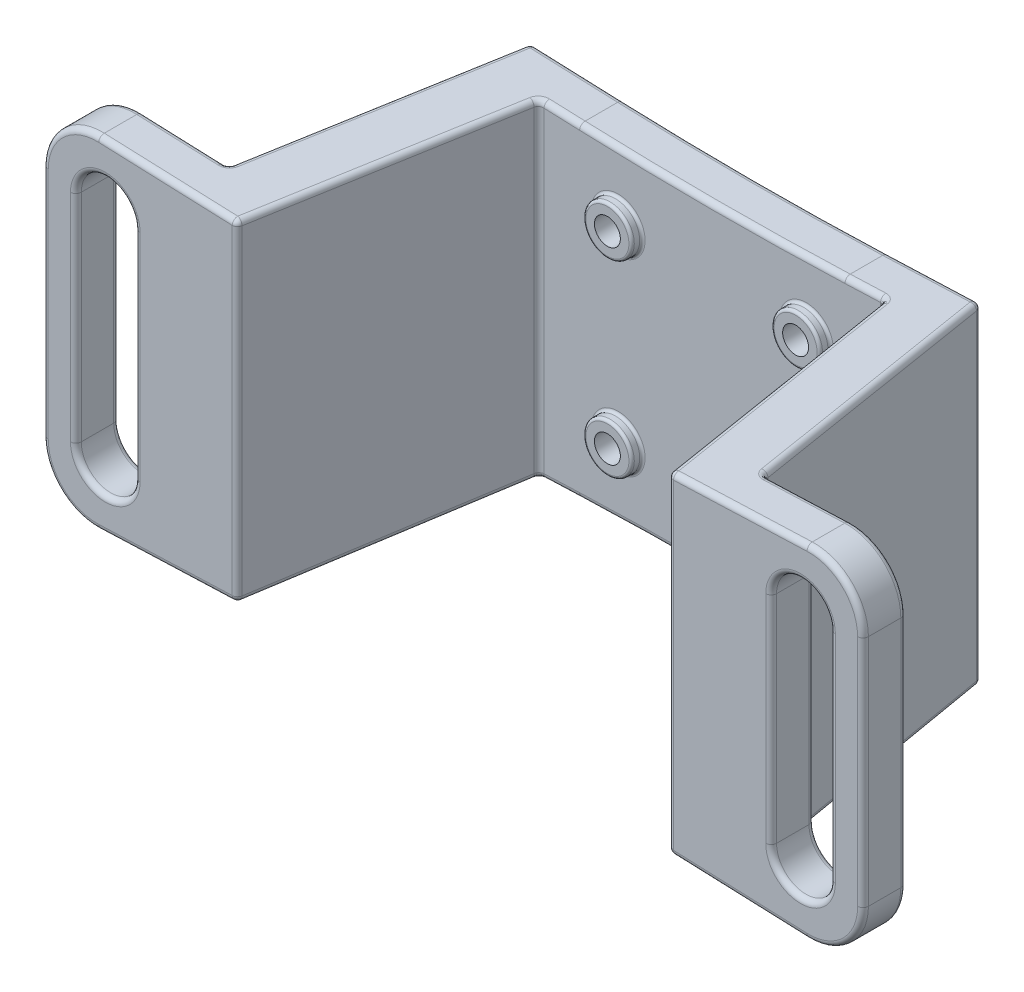
from build123d import *

# Parameters (mm, degrees)
SKETCH1_R           = 1.9049999999999998
SKETCH1_R_2         = 1.905
SKETCH1_R_3         = 1.9050000000000002
BOSS_EXTRUDE1_DEPTH = 3.175
FILLET1_R           = 3.96875
BOSS_EXTRUDE2_START = -1.5875
SKETCH2_R           = 1.9050000000000002
SKETCH2_R_2         = 0.9525000000000001
SKETCH2_R_3         = 1.905
SKETCH2_R_4         = 0.9525
SKETCH2_R_5         = 1.9049999999999998
SKETCH2_R_6         = 0.9525000000000002
SKETCH2_R_7         = 0.9525000000000003
BOSS_EXTRUDE2_DEPTH = 1.5875
SKETCH4_R           = 1.778
SKETCH4_R_2         = 0.9525000000000005
SKETCH4_R_3         = 1.7779999999999996
SKETCH4_R_4         = 0.9525000000000002
SKETCH4_R_5         = 0.9525000000000001
SKETCH4_R_6         = 0.9525
BOSS_EXTRUDE3_DEPTH = 0.79375
BOSS_EXTRUDE4_DEPTH = 19.05
CUT_EXTRUDE1_DEPTH  = 19.05
CHAMFER1_SIZE       = 3.175
CHAMFER1_SIZE_2     = 19.05
CHAMFER4_SIZE       = 3.175
CHAMFER4_SIZE_2     = 19.05
CHAMFER2_SIZE       = 19.05
CHAMFER2_SIZE_2     = 3.175
CHAMFER3_SIZE       = 3.175
CHAMFER3_SIZE_2     = 19.05
FILLET2_R           = 0.1984375
FILLET4_R           = 254
FILLET3_R           = 0.396875


with BuildPart() as part:
    # Sketch1 → Boss-Extrude1 (new body)
    # profile 1 of 3: a face of its own
    with BuildSketch(Plane.XY):
        Polygon((18.191489852910465, 4.201032999999999), (6.911467000002631, 4.633592791574014), (-4.368555852910468, 4.201032999999999), (-4.368555852910467, -18.023967), (6.911467000002645, -18.456526791574216), (18.191489852910465, -18.023967), align=None)
        with Locations((0, -13.822933999999998)):
            Circle(SKETCH1_R, mode=Mode.SUBTRACT)
        with Locations((13.822933999999998, -13.822933999999995)):
            Circle(SKETCH1_R_2, mode=Mode.SUBTRACT)
        Circle(SKETCH1_R_2, mode=Mode.SUBTRACT)
        with Locations((13.822933999999998, 0)):
            Circle(SKETCH1_R_3, mode=Mode.SUBTRACT)
    # profile 2 of 3: a face of its own
    with BuildSketch(Plane.XY):
        Polygon((6.911467000002631, 4.633592791574014), (-23.206339135841382, 5.788532999999999), (-23.206339135841382, -19.611466999999998), (6.911467000002652, -18.456526791574014), (-4.368555852910468, -18.023967), (-4.368555852910467, 4.201032999999999), align=None)
        with BuildLine():
            ThreePointArc((-20.77872400000001, 1.026033000000001), (-18.619723999999994, 3.185033000000017), (-16.460723999999978, 1.0260330000000009))
            Line((-16.46072399999998, 1.0260330000000009), (-16.46072399999998, -14.848966999999998))
            ThreePointArc((-16.460723999999978, -14.848967), (-18.619723999999994, -17.007967000000015), (-20.77872400000001, -14.848967))
            Line((-20.77872400000001, -14.848966999999998), (-20.77872400000001, 1.0260330000000009))
        make_face(mode=Mode.SUBTRACT)
    # profile 3 of 3: a face of its own
    with BuildSketch(Plane.XY):
        Polygon((37.02927313584138, 5.788532999999999), (6.911467000002624, 4.633592791574215), (18.191489852910465, 4.201032999999999), (18.191489852910465, -18.023967), (6.911467000002652, -18.456526791574014), (37.02927313584138, -19.611467), align=None)
        with BuildLine():
            Line((30.283657999999978, -14.848966999999998), (30.283657999999978, 1.0260330000000009))
            ThreePointArc((30.28365799999998, 1.0260330000000009), (32.442657999999994, 3.185033000000025), (34.60165800000001, 1.0260330000000015))
            Line((34.60165800000001, 1.0260330000000009), (34.60165800000001, -14.848966999999998))
            ThreePointArc((34.60165800000001, -14.848967), (32.442657999999994, -17.007967000000008), (30.28365799999998, -14.848967))
        make_face(mode=Mode.SUBTRACT)
    extrude(amount=BOSS_EXTRUDE1_DEPTH)

    # Fillet1
    fillet1_edges = [part.edges().sort_by_distance(p)[0] for p in [
        (37.02927313584138, 5.788532999999999, 1.5875),
        (37.02927313584138, -19.611466999999998, 1.5875),
        (-23.206339135841382, -19.611466999999998, 1.5875),
        (-23.206339135841382, 5.788532999999999, 1.5875),
    ]]
    fillet(fillet1_edges, radius=FILLET1_R)

    # Sketch2 → Boss-Extrude2 (add)
    # profile 1 of 4: a face of its own
    with BuildSketch(Plane.XY.offset(3.175).offset(BOSS_EXTRUDE2_START)):
        with Locations((13.822933999999998, 0)):
            Circle(SKETCH2_R)
        with Locations((13.822933999999998, 0)):
            Circle(SKETCH2_R_2, mode=Mode.SUBTRACT)
    # profile 2 of 4: a face of its own
    with BuildSketch(Plane.XY.offset(3.175).offset(BOSS_EXTRUDE2_START)):
        with Locations((13.822933999999998, -13.822933999999995)):
            Circle(SKETCH2_R_3)
        with Locations((13.822933999999998, -13.822933999999995)):
            Circle(SKETCH2_R_4, mode=Mode.SUBTRACT)
    # profile 3 of 4: a face of its own
    with BuildSketch(Plane.XY.offset(3.175).offset(BOSS_EXTRUDE2_START)):
        with Locations((0, -13.822933999999998)):
            Circle(SKETCH2_R_5)
        with Locations((0, -13.822933999999998)):
            Circle(SKETCH2_R_6, mode=Mode.SUBTRACT)
    # profile 4 of 4: a face of its own
    with BuildSketch(Plane.XY.offset(3.175).offset(BOSS_EXTRUDE2_START)):
        Circle(SKETCH2_R_3)
        Circle(SKETCH2_R_7, mode=Mode.SUBTRACT)
    extrude(amount=BOSS_EXTRUDE2_DEPTH)

    # Sketch4 → Boss-Extrude3 (add)
    # profile 1 of 4: a face of its own
    with BuildSketch(Plane.XY.offset(3.175)):
        Circle(SKETCH4_R)
        Circle(SKETCH4_R_2, mode=Mode.SUBTRACT)
    # profile 2 of 4: a face of its own
    with BuildSketch(Plane.XY.offset(3.175)):
        with Locations((0, -13.822933999999998)):
            Circle(SKETCH4_R_3)
        with Locations((0, -13.822933999999998)):
            Circle(SKETCH4_R_4, mode=Mode.SUBTRACT)
    # profile 3 of 4: a face of its own
    with BuildSketch(Plane.XY.offset(3.175)):
        with Locations((13.822933999999998, 0)):
            Circle(SKETCH4_R_3)
        with Locations((13.822933999999998, 0)):
            Circle(SKETCH4_R_5, mode=Mode.SUBTRACT)
    # profile 4 of 4: a face of its own
    with BuildSketch(Plane.XY.offset(3.175)):
        with Locations((13.822933999999998, -13.822933999999995)):
            Circle(SKETCH4_R_3)
        with Locations((13.822933999999998, -13.822933999999995)):
            Circle(SKETCH4_R_6, mode=Mode.SUBTRACT)
    extrude(amount=BOSS_EXTRUDE3_DEPTH)

    # Sketch5 → Boss-Extrude4 (add)
    # profile 1 of 2: a face of its own
    with BuildSketch(Plane(origin=(0, 0, 3.175), x_dir=(-1, 0, 0), z_dir=(0, 0, -1))):
        with BuildLine():
            Line((-32.90844358380976, -19.453443811981426), (-19.611467000000005, -18.94353904541665))
            Line((-19.611467000000008, -18.943539045416653), (-19.611467000000008, 5.120605045416653))
            Line((-19.61146700000001, 5.120605045416652), (-32.90844358380976, 5.630509811981427))
            ThreePointArc((-32.90844358380976, 5.630509811981425), (-35.812559730835574, 4.524267498192314), (-37.02927313584138, 1.6646746701287234))
            Line((-37.02927313584138, 1.664674670128723), (-37.02927313584138, -15.487608670128722))
            ThreePointArc((-37.02927313584138, -15.487608670128722), (-35.812559730835574, -18.347201498192312), (-32.90844358380976, -19.453443811981426))
        make_face()
        with BuildLine():
            Line((-34.60165800000001, -14.848966999999998), (-34.60165800000001, 1.0260330000000009))
            ThreePointArc((-34.60165800000001, 1.0260330000000015), (-32.442657999999994, 3.185033000000025), (-30.28365799999998, 1.0260330000000009))
            Line((-30.283657999999978, 1.026033), (-30.283657999999985, -14.848967))
            ThreePointArc((-30.28365799999998, -14.848967), (-32.442657999999994, -17.007967000000008), (-34.60165800000001, -14.848967))
        make_face(mode=Mode.SUBTRACT)
    # profile 2 of 2: a face of its own
    with BuildSketch(Plane(origin=(0, 0, 3.175), x_dir=(-1, 0, 0), z_dir=(0, 0, -1))):
        with BuildLine():
            Line((5.788532999999995, 5.120605045416653), (5.788532999999994, -18.943539045416653))
            Line((5.788532999999996, -18.943539045416653), (19.08550958380976, -19.453443811981426))
            ThreePointArc((19.08550958380976, -19.453443811981426), (21.989625730835577, -18.34720149819232), (23.206339135841382, -15.487608670128724))
            Line((23.206339135841382, -15.487608670128724), (23.206339135841382, 1.6646746701287238))
            ThreePointArc((23.206339135841382, 1.664674670128724), (21.989625730835577, 4.5242674981923185), (19.08550958380976, 5.630509811981427))
            Line((19.08550958380976, 5.630509811981428), (5.78853299999999, 5.120605045416652))
        make_face()
        with BuildLine():
            Line((20.77872400000001, 1.026033), (20.77872400000001, -14.848967))
            ThreePointArc((20.77872400000001, -14.848967), (18.619723999999994, -17.007967000000015), (16.460723999999978, -14.848967))
            Line((16.46072399999998, -14.848967), (16.46072399999998, 1.026033000000001))
            ThreePointArc((16.460723999999978, 1.0260330000000015), (18.619723999999994, 3.1850330000000135), (20.77872400000001, 1.0260330000000009))
        make_face(mode=Mode.SUBTRACT)
    extrude(amount=-BOSS_EXTRUDE4_DEPTH)

    # Sketch6 → Cut-Extrude1 (cut)
    # profile 1 of 2: a face of its own
    with BuildSketch(Plane.XY):
        with BuildLine():
            Line((-19.08550958380976, -19.453443811981426), (-12.773532999999995, -19.211395785030046))
            Line((-12.773532999999995, -19.211395785030046), (-12.773532999999995, 5.388461785030049))
            Line((-12.773533, 5.3884617850300485), (-19.08550958380976, 5.630509811981428))
            ThreePointArc((-19.08550958380976, 5.630509811981428), (-21.989625730835577, 4.524267498192319), (-23.206339135841382, 1.664674670128724))
            Line((-23.206339135841382, 1.664674670128724), (-23.206339135841382, -15.487608670128724))
            ThreePointArc((-23.206339135841382, -15.487608670128724), (-21.989625730835577, -18.34720149819232), (-19.08550958380976, -19.453443811981426))
        make_face()
        with BuildLine():
            Line((-16.46072399999998, 1.026033), (-16.46072399999998, -14.848967))
            ThreePointArc((-16.460723999999978, -14.848967), (-18.619723999999994, -17.007967000000015), (-20.77872400000001, -14.848967))
            Line((-20.77872400000001, -14.848967), (-20.77872400000001, 1.026033000000001))
            ThreePointArc((-20.77872400000001, 1.026033000000001), (-18.619723999999994, 3.185033000000017), (-16.460723999999978, 1.0260330000000009))
        make_face(mode=Mode.SUBTRACT)
    # profile 2 of 2: a face of its own
    with BuildSketch(Plane.XY):
        with BuildLine():
            Line((26.596467000000008, 5.388461785030049), (26.596467000000008, -19.211395785030046))
            Line((26.59646700000001, -19.211395785030046), (32.90844358380976, -19.453443811981426))
            ThreePointArc((32.90844358380976, -19.453443811981426), (35.812559730835574, -18.347201498192312), (37.02927313584138, -15.487608670128722))
            Line((37.02927313584138, -15.487608670128722), (37.02927313584138, 1.664674670128722))
            ThreePointArc((37.02927313584138, 1.664674670128723), (35.81255973083558, 4.524267498192318), (32.90844358380976, 5.630509811981428))
            Line((32.90844358380976, 5.630509811981427), (26.596467000000008, 5.388461785030048))
        make_face()
        with BuildLine():
            Line((34.60165800000001, 1.026033), (34.60165800000001, -14.848967))
            ThreePointArc((34.60165800000001, -14.848967), (32.442657999999994, -17.007967000000022), (30.28365799999998, -14.848967))
            Line((30.283657999999978, -14.848967), (30.283657999999985, 1.026033000000001))
            ThreePointArc((30.28365799999998, 1.026033000000001), (32.442657999999994, 3.1850330000000064), (34.60165800000001, 1.0260330000000009))
        make_face(mode=Mode.SUBTRACT)
    extrude(amount=CUT_EXTRUDE1_DEPTH, mode=Mode.SUBTRACT)

    # Chamfer1
    # the kernel refuses this chamfer: 19.05, 3.175 mm, written as the material it takes off along each edge
    with BuildSketch(Plane(origin=(-12.773532999999997, -68.71646684317264, 0), x_dir=(0.9750324932942596, 0, -0.22206223681747386), z_dir=(0, 1, 0))) as chamfer1_piece_1_section:
        Polygon((CHAMFER1_SIZE * 0.975032493294, -CHAMFER1_SIZE * 0.222062236817), (-CHAMFER1_SIZE_2 * 0.222062236817, -CHAMFER1_SIZE_2 * 0.975032493294), (0, 0), align=None)
    chamfer1_piece_1 = extrude(amount=123.60999968634529, mode=Mode.PRIVATE)
    chamfer1_piece_1 = split(chamfer1_piece_1, bisect_by=Plane(origin=(-11.920164400412823, -6.911466999999995, 19.05), z_dir=(0, 0, -1)), keep=Keep.TOP, mode=Mode.PRIVATE)
    add(chamfer1_piece_1, mode=Mode.SUBTRACT)

    # Chamfer4
    # the kernel refuses this chamfer: 19.05, 3.175 mm, written as the material it takes off along each edge
    with BuildSketch(Plane(origin=(26.596467000000008, 54.89353284317265, 0), x_dir=(-0.9750324932942595, 0, -0.2220622368174737), z_dir=(0, -1, 0))) as chamfer4_piece_1_section:
        Polygon((CHAMFER4_SIZE * 0.975032493294, -CHAMFER4_SIZE * 0.222062236817), (-CHAMFER4_SIZE_2 * 0.222062236817, -CHAMFER4_SIZE_2 * 0.975032493294), (0, 0), align=None)
    chamfer4_piece_1 = extrude(amount=123.6099996863453, mode=Mode.PRIVATE)
    chamfer4_piece_1 = split(chamfer4_piece_1, bisect_by=Plane(origin=(25.74309840041287, -6.911467000000007, 19.05), z_dir=(0, 0, -1)), keep=Keep.TOP, mode=Mode.PRIVATE)
    add(chamfer4_piece_1, mode=Mode.SUBTRACT)

    # Chamfer2
    # the kernel refuses this chamfer: 19.05, 3.175 mm, written as the material it takes off along each edge
    with BuildSketch(Plane(origin=(19.611467000000008, -68.44861010355925, 22.225), x_dir=(-0.0063262220237778645, 0, -0.999979989257238), z_dir=(0, 1, 0))) as chamfer2_piece_1_section:
        Polygon((CHAMFER2_SIZE * 0.999979989257, -CHAMFER2_SIZE * 0.00632622202378), (-CHAMFER2_SIZE_2 * 0.00632622202378, -CHAMFER2_SIZE_2 * 0.999979989257), (0, 0), align=None)
    chamfer2_piece_1 = extrude(amount=123.07428620711849, mode=Mode.PRIVATE)
    chamfer2_piece_1 = split(chamfer2_piece_1, bisect_by=Plane(origin=(20.46483559958715, -6.911467000000003, 3.175), z_dir=(0, 0, 1)), keep=Keep.TOP, mode=Mode.PRIVATE)
    add(chamfer2_piece_1, mode=Mode.SUBTRACT)

    # Chamfer3
    # the kernel refuses this chamfer: 19.05, 3.175 mm, written as the material it takes off along each edge
    with BuildSketch(Plane(origin=(-5.788532999999996, 54.62567610355924, 22.225), x_dir=(-0.9750324932942596, 0, 0.2220622368174738), z_dir=(4e-17, -1, 0))) as chamfer3_piece_1_section:
        Polygon((CHAMFER3_SIZE * 0.975032493294, CHAMFER3_SIZE * 0.222062236817), (-CHAMFER3_SIZE_2 * 0.222062236817, CHAMFER3_SIZE_2 * 0.975032493294), (0, 0), align=None)
    chamfer3_piece_1 = extrude(amount=123.07428620711849, mode=Mode.PRIVATE)
    chamfer3_piece_1 = split(chamfer3_piece_1, bisect_by=Plane(origin=(-6.641901599587179, -6.9114669999999965, 3.175), z_dir=(0, 0, 1)), keep=Keep.TOP, mode=Mode.PRIVATE)
    add(chamfer3_piece_1, mode=Mode.SUBTRACT)

    # Fillet2
    fillet2_edges = [part.edges().sort_by_distance(p)[0] for p in [
        (-1.905, 2.3e-16, 1.5875),
        (-1.9049999999999998, -13.822933999999998, 1.5875),
        (12.044933999999998, 2.2e-16, 3.96875),
        (12.044933999999998, 2.2e-16, 3.175),
        (-1.7779999999999996, -13.822933999999998, 3.96875),
        (-1.7779999999999996, -13.822933999999998, 3.175),
        (-1.778, 2.2e-16, 3.96875),
        (-1.778, 2.2e-16, 3.175),
        (12.044933999999998, -13.822933999999995, 3.96875),
        (12.044933999999998, -13.822933999999995, 3.175),
        (-1.905, 2.3e-16, 0),
        (11.917933999999999, 2.3e-16, 0),
        (11.917933999999999, -13.822933999999995, 0),
        (-1.9049999999999998, -13.822933999999998, 0),
        (11.917933999999999, -13.822933999999995, 1.5875),
        (11.917933999999999, 2.3e-16, 1.5875),
    ]]
    fillet(fillet2_edges, radius=FILLET2_R)

    # Fillet4
    # the kernel refuses this fillet: 254 mm, written as the material it adds along each edge
    with BuildSketch(Plane(origin=(6.911467000002649, -18.456526791574113, 0), x_dir=(0.9992655475534369, -0.03831925720482969, 0), z_dir=(0, 0, 1))) as fillet4_piece_1:
        with BuildLine():
            CenterArc((FILLET4_R * 0.0383474215624, -FILLET4_R), FILLET4_R, 90.00000000000064, 4.392138748832977)
            Line((-FILLET4_R * 0.0382348055028, -FILLET4_R * 0.00293673094546), (0, 0))
            Line((0, 0), (FILLET4_R * 0.0383474215624, 3e-17))
        make_face()
    extrude(amount=3.175)
    with BuildSketch(Plane(origin=(6.911467000002627, 4.633592791574115, 0), x_dir=(-0.9992655475534378, 0.038319257204808777, 0), z_dir=(0, 0, 1))) as fillet4_piece_2:
        with BuildLine():
            CenterArc((FILLET4_R * 0.0383474215624, -FILLET4_R), FILLET4_R, 89.99999999999943, 4.392138748832977)
            Line((-FILLET4_R * 0.0382348055028, -FILLET4_R * 0.00293673094546), (0, 0))
            Line((0, 0), (FILLET4_R * 0.0383474215624, -1e-17))
        make_face()
    extrude(amount=3.175)

    # Fillet3
    fillet3_edges = [part.edges().sort_by_distance(p)[0] for p in [
        (18.128012665011795, -18.886652396664285, 3.175),
        (-4.305078665010413, -18.88665239666423, 3.175),
        (-4.3050786650109885, 5.063718396664252, 3.175),
        (18.12801266501121, 5.063718396664261, 3.175),
        (35.812559730835574, -18.347201498192312, 22.225),
        (37.02927313584138, -6.911466999999999, 22.225),
        (35.812559730835574, 4.524267498192313, 22.225),
        (27.847455291904506, 5.436433960429342, 22.225),
        (32.442657999999994, 3.1850330000000238, 22.225),
        (34.60165800000001, -6.911466999999998, 22.225),
        (32.442657999999994, -17.007967000000008, 22.225),
        (30.28365799999998, -6.911467, 22.225),
        (19.611467000000008, -6.911467, 3.175),
        (-5.788532999999994, -6.911467, 3.175),
        (-16.46072399999998, -6.911466999999999, 22.225),
        (-18.619723999999994, -17.00796700000002, 22.225),
        (-20.77872400000001, -6.911467, 22.225),
        (-18.619723999999994, 3.185033000000015, 22.225),
        (-14.024521291904312, -19.259367960429334, 22.225),
        (-21.989625730835577, 4.524267498192318, 22.225),
        (-23.206339135841382, -6.911467, 22.225),
        (-21.989625730835577, -18.34720149819232, 22.225),
        (-20.77872400000001, -6.911466999999999, 19.05),
        (-18.619723999999994, 3.1850330000000184, 19.05),
        (-16.46072399999998, -6.911467, 19.05),
        (-15.92952129190488, 5.509485798505738, 19.05),
        (-21.989625730835577, 4.524267498192319, 19.05),
        (-23.206339135841382, -6.911467, 19.05),
        (-21.989625730835577, -18.34720149819232, 19.05),
        (-15.929521291904877, -19.332419798505736, 19.05),
        (-18.619723999999994, -17.00796700000002, 19.05),
        (-12.773532999999995, -6.911466999999998, 19.05),
        (29.752455291904887, -19.332419798505736, 19.05),
        (35.812559730835574, -18.347201498192312, 19.05),
        (37.02927313584138, -6.911467, 19.05),
        (35.81255973083558, 4.524267498192319, 19.05),
        (29.752455291904887, 5.509485798505737, 19.05),
        (32.442657999999994, -17.007967000000022, 19.05),
        (30.28365799999998, -6.911466999999999, 19.05),
        (32.442657999999994, 3.185033000000005, 19.05),
        (34.60165800000001, -6.911467, 19.05),
        (26.596467000000008, -6.911466999999998, 19.05),
        (-6.210078665011572, 5.136770234740656, 0),
        (-6.210078665010997, -18.95970423474063, 0),
        (-9.598533000001138, -6.911467000000002, 0),
        (-11.186033000000577, 5.3275852532997705, 9.524999999996593),
        (-11.186033000000574, -19.150519253299745, 9.524999999996588),
        (20.033012665011775, 5.136770234740664, 0),
        (25.008967000000567, 5.327585253299749, 9.52499999999659),
        (20.033012665012365, -18.959704234740688, 0),
        (23.421467000001137, -6.911467000000002, 0),
        (25.008967000000567, -19.150519253299766, 9.524999999996592),
        (21.198966999997527, 5.181481577146872, 12.70000000000192),
        (27.847455291904502, -19.25936796042934, 22.225),
        (22.786466999999245, -6.911466999999995, 22.2249999999993),
        (21.198966999997527, -19.004415577146872, 12.700000000001914),
        (-14.02452129190431, 5.436433960429335, 22.225),
        (-8.963532999998863, -6.911467000000002, 22.225),
        (-7.37603299999944, 5.181481577146937, 12.700000000003412),
        (-7.376032999999434, -19.004415577146972, 12.700000000003413),
        (6.911466999999862, 4.82028082648485, 0),
        (6.911466999999862, 4.82028082648485, 3.175),
        (6.911466999997281, -18.64321482648485, 0),
        (6.911466999997281, -18.64321482648485, 3.175),
    ]]
    fillet(fillet3_edges, radius=FILLET3_R)


solid = part.part
